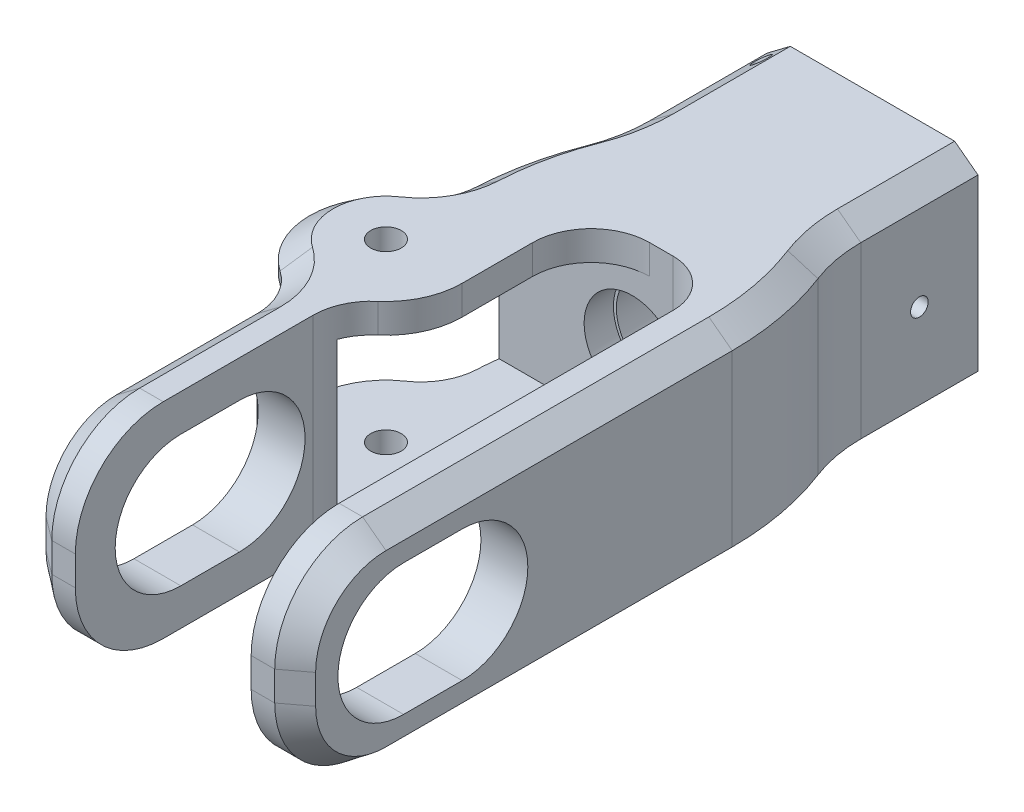
from build123d import *
from OCP.BRepFilletAPI import BRepFilletAPI_MakeChamfer
from build123d.topology import SkipClean

# Parameters (mm, degrees)
SKETCH1_W               = 46
SKETCH1_H               = 35
SKETCH1_R               = 7.7
BOSS_EXTRUDE1_DEPTH     = 36
BOSS_EXTRUDE2_START     = 1
SKETCH2_R               = 11
SKETCH2_R_2             = 7.7
BOSS_EXTRUDE2_DEPTH     = 1
SKETCH5_W               = 8
SKETCH5_H               = 35
BOSS_EXTRUDE4_DEPTH     = 85
SKETCH3_W               = 38
SKETCH3_H               = 35
SKETCH3_R               = 8.2
BOSS_EXTRUDE3_DEPTH     = 5
CUT_EXTRUDE1_DEPTH      = 125.403577119
CUT_EXTRUDE1_DEPTH_BACK = 125.403577119
SKETCH4_R               = 2.6
BOSS_EXTRUDE6_REACH     = 130.043
SKETCH9_W               = 8
SKETCH9_H               = 35
BOSS_EXTRUDE5_DEPTH     = 80
FILLET1_R               = 15
FILLET9_R               = 10
FILLET11_R              = 8
CUT_EXTRUDE2_DEPTH      = 35
FILLET12_R              = 50
SKETCH6_W               = 26
SKETCH6_H               = 36
CUT_EXTRUDE3_DEPTH      = 12.5
FILLET13_R              = 10
CUT_EXTRUDE4_REACH      = 132.626
CHAMFER1_SIZE           = 3
CHAMFER1_SIZE2          = 3.981134465
CUT_EXTRUDE5_REACH      = 134.47
CUT_EXTRUDE5_END_RADIUS = 7.7
SKETCH23_R              = 1.5
SKETCH25_R              = 1.5
CUT_EXTRUDE6_DEPTH      = 10


with BuildPart() as part:
    # Sketch1 → Boss-Extrude1 (new body)
    with BuildSketch(Plane.XY):
        Rectangle(SKETCH1_W, SKETCH1_H)
        Circle(SKETCH1_R, mode=Mode.SUBTRACT)
    extrude(amount=BOSS_EXTRUDE1_DEPTH)

    # Sketch2 → Boss-Extrude2 (add)
    with SkipClean():  # the faces are left unmerged after this step: merging them gives an invalid solid
        with BuildSketch(Plane(origin=(0, 0, 0), x_dir=(-1, 0, 0), z_dir=(0, 0, -1)).offset(BOSS_EXTRUDE2_START)):
            Circle(SKETCH2_R)
            Circle(SKETCH2_R_2, mode=Mode.SUBTRACT)
        extrude(amount=-BOSS_EXTRUDE2_DEPTH)

    # Sketch5 → Boss-Extrude4 (add)
    with SkipClean():  # the faces are left unmerged after this step: merging them gives an invalid solid
        with BuildSketch(Plane.XY.offset(36)):
            with Locations((-19, 0)):
                Rectangle(SKETCH5_W, SKETCH5_H)
        extrude(amount=BOSS_EXTRUDE4_DEPTH)

    # Sketch3 → Boss-Extrude3 (add)
    with BuildSketch(Plane.XY.offset(36)):
        with Locations((4, 0)):
            Rectangle(SKETCH3_W, SKETCH3_H)
        Circle(SKETCH3_R, mode=Mode.SUBTRACT)
    extrude(amount=BOSS_EXTRUDE3_DEPTH)

    # Sketch4 → Cut-Extrude1 (cut, two sides: drawn at the far end of the back side and taken through both)
    with BuildSketch(Plane(origin=(0, 0, 0), x_dir=(1, 0, 0), z_dir=(0, 1, 0)).offset(-CUT_EXTRUDE1_DEPTH_BACK)):
        with Locations(Location((-20, -63, 0), (0, 0, 270))):
            Circle(SKETCH4_R)
    extrude(amount=CUT_EXTRUDE1_DEPTH + CUT_EXTRUDE1_DEPTH_BACK, mode=Mode.SUBTRACT)

    # Boss-Extrude6: up to this face of the body (flat: up to its plane)
    boss_extrude6_end = Plane(part.part.faces().sort_by_distance((-4.685176782, -17.5, 35.598204078))[0])
    # Sketch10 → Boss-Extrude6 (add, up to the picked face)
    with BuildSketch(Plane(origin=(0, 17.5, 0), x_dir=(1, 0, 0), z_dir=(0, 1, 0)), mode=Mode.PRIVATE) as boss_extrude6_sk1:
        with BuildLine():
            Line((-23, -50.350889359), (-23, -75.649110641))
            ThreePointArc((-23, -75.649110641), (-33, -63), (-23, -50.350889359))
        make_face()
    boss_extrude6_tool1 = split(extrude(boss_extrude6_sk1.sketch, amount=-BOSS_EXTRUDE6_REACH, mode=Mode.PRIVATE), bisect_by=boss_extrude6_end, keep=Keep.BOTH, mode=Mode.PRIVATE)
    # Sketch10 → Boss-Extrude6 (add, up to the picked face)
    with BuildSketch(Plane(origin=(0, 17.5, 0), x_dir=(1, 0, 0), z_dir=(0, 1, 0)), mode=Mode.PRIVATE) as boss_extrude6_sk2:
        with BuildLine():
            Line((-15, -41), (-15, -75))
            ThreePointArc((-15, -75), (-9.183346174, -70.211102551), (-7, -63))
            Line((-7, -63), (-7, -41))
            Line((-7, -41), (-15, -41))
        make_face()
    boss_extrude6_tool2 = split(extrude(boss_extrude6_sk2.sketch, amount=-BOSS_EXTRUDE6_REACH, mode=Mode.PRIVATE), bisect_by=boss_extrude6_end, keep=Keep.BOTH, mode=Mode.PRIVATE)
    add(boss_extrude6_tool1.solids().sort_by(Axis((-27.170601, 17.5, 63), (0, -1, 0)))[0])
    add(boss_extrude6_tool2.solids().sort_by(Axis((-11.197055, 17.5, 56.457565), (0, -1, 0)))[0])

    # Sketch9 → Boss-Extrude5 (add)
    with BuildSketch(Plane.XY.offset(41)):
        with Locations((19, 0)):
            Rectangle(SKETCH9_W, SKETCH9_H)
    extrude(amount=BOSS_EXTRUDE5_DEPTH)

    # Fillet1
    fillet1_edges = [part.edges().sort_by_distance(p)[0] for p in [
        (-19, -17.5, 121),
        (-19, 17.5, 121),
        (19, 17.5, 121),
        (19, -17.5, 121),
    ]]
    fillet(fillet1_edges, radius=FILLET1_R)

    # Fillet9
    fillet9_edges = [part.edges().sort_by_distance(p)[0] for p in [
        (-23, 0, 75.649110641),
        (-23, 0, 50.350889359),
        (-15, 0, 75),
    ]]
    fillet(fillet9_edges, radius=FILLET9_R)

    # Fillet11
    fillet11_edges = [part.edges().sort_by_distance(p)[0] for p in [
        (15, 0, 41),
    ]]
    fillet(fillet11_edges, radius=FILLET11_R)

    # Sketch20 → Cut-Extrude2 (cut)
    with BuildSketch(Plane(origin=(0, 17.5, 0), x_dir=(1, 0, 0), z_dir=(0, 1, 0))):
        with BuildLine():
            Line((-18, 0), (-18, -20))
            ThreePointArc((-18, -20), (-19.282917549, -27.90569415), (-23, -35))
            Line((-23, -35), (-23, 0))
            Line((-23, 0), (-18, 0))
        make_face()
        with BuildLine():
            Line((18, -20), (18, 0))
            Line((18, 0), (23, 0))
            Line((23, 0), (23, -35))
            ThreePointArc((23, -35), (19.282917549, -27.90569415), (18, -20))
        make_face()
    extrude(amount=-CUT_EXTRUDE2_DEPTH, mode=Mode.SUBTRACT)

    # Fillet12
    # the kernel refuses this fillet: 50 mm, written as the material it takes off along each edge
    with BuildSketch(Plane(origin=(23, 47.314560089, 35), x_dir=(0, 0, 1), z_dir=(0, -1, 0))) as fillet12_piece_1:
        with BuildLine():
            CenterArc((11.925824036, 50), FILLET12_R, 248.960530219, 21.039469781)
            ThreePointArc((-6.024725321, 3.333333333), (-2.897057104, 1.87507196), (0, 0))
            Line((0, 0), (11.925824036, 0))
        make_face()
    extrude(amount=94.629120178, mode=Mode.SUBTRACT)
    with BuildSketch(Plane(origin=(-23, 41.360846345, 35), x_dir=(0.4854209335921463, 0, -0.8742805712301568), z_dir=(0, -1, 0))) as fillet12_piece_2:
        with BuildLine():
            CenterArc((13.623159586, 49.533850857), FILLET12_R, 243.929167388, 18.240989477)
            Line((-8.350938249, 4.621279963), (-10.548348032, 0.130022873))
            ThreePointArc((-10.548348032, 0.130022873), (-10.318653148, 0.01016864), (-2.427104668, -4.371402856))
            Line((-2.427104668, -4.371402856), (0.681157979, -4.953385086))
            ThreePointArc((0.681157979, -4.953385086), (3.405789897, -4.766925428), (6.130421814, -4.953385086))
            Line((6.130421814, -4.953385086), (6.811579793, 0))
        make_face()
    extrude(amount=82.721692689, mode=Mode.SUBTRACT)

    # Sketch6 → Cut-Extrude3 (cut, symmetric)
    with BuildSketch(Plane(origin=(0, 0, 0), x_dir=(1, 0, 0), z_dir=(0, 1, 0))):
        with Locations((-20, -59)):
            Rectangle(SKETCH6_W, SKETCH6_H)
    extrude(amount=CUT_EXTRUDE3_DEPTH, both=True, mode=Mode.SUBTRACT)

    # Fillet13
    fillet13_edges = [part.edges().sort_by_distance(p)[0] for p in [
        (-7, 15, 41),
        (-7, -15, 41),
    ]]
    fillet(fillet13_edges, radius=FILLET13_R)

    # Cut-Extrude4: up to this face of the body (flat: up to its plane)
    cut_extrude4_end = Plane(part.part.faces().sort_by_distance((23, 0, 82.65958398))[0])
    # Sketch22 → Cut-Extrude4 (cut, up to the picked face)
    with BuildSketch(Plane.ZY.offset(23), mode=Mode.PRIVATE) as cut_extrude4_sk1:
        with BuildLine():
            Line((93, 11.2), (103, 11.2))
            ThreePointArc((103, 11.2), (114.2, 0), (103, -11.2))
            Line((103, -11.2), (93, -11.2))
            ThreePointArc((93, -11.2), (81.8, 0), (93, 11.2))
        make_face()
    cut_extrude4_tool1 = split(extrude(cut_extrude4_sk1.sketch, amount=-CUT_EXTRUDE4_REACH, mode=Mode.PRIVATE), bisect_by=cut_extrude4_end, keep=Keep.BOTH, mode=Mode.PRIVATE)
    add(cut_extrude4_tool1.solids().sort_by(Axis((-23, 0, 98), (1, 0, 0)))[0], mode=Mode.SUBTRACT)

    # Chamfer1: one chamfer whose edges measure the first distance from different faces: ONE call of the kernel's chamfer builder (chamfer() names one face for all edges)
    chamfer1_edges_1 = [part.edges().sort_by_distance(p)[0] for p in [
        (-23, 17.5, 93.986832981),
        (-23, 0, 121),
        (-23, 13.106601718, 116.606601718),
        (-23, -13.106601718, 116.606601718),
        (-23, -17.5, 93.986832981),
    ]]
    chamfer1_side_1 = [part.faces().sort_by_distance(p)[0] for p in [
        (-23, -16.975781081, 93.986832981),
    ]]
    chamfer1_edges_2 = [part.edges().sort_by_distance(p)[0] for p in [
        (-33, -17.5, 63),
    ]]
    chamfer1_side_2 = [part.faces().sort_by_distance(p)[0] for p in [
        (-33, -15, 63),
    ]]
    chamfer1_edges_3 = [part.edges().sort_by_distance(p)[0] for p in [
        (-33, 17.5, 63),
    ]]
    chamfer1_side_3 = [part.faces().sort_by_distance(p)[0] for p in [
        (-33, 15, 63),
    ]]
    chamfer1_edges_4 = [part.edges().sort_by_distance(p)[0] for p in [
        (-24.277251002, -17.5, 48.916492514),
    ]]
    chamfer1_side_4 = [part.faces().sort_by_distance(p)[0] for p in [
        (-24.277251002, -15, 48.916492514),
    ]]
    chamfer1_edges_5 = [part.edges().sort_by_distance(p)[0] for p in [
        (-24.153482631, 17.5, 77.31114192),
        (-24.153482631, -17.5, 77.31114192),
    ]]
    chamfer1_side_5 = [part.faces().sort_by_distance(p)[0] for p in [
        (-24.153482631, 0, 77.31114192),
    ]]
    chamfer1_edges_6 = [part.edges().sort_by_distance(p)[0] for p in [
        (-18, 17.5, 10),
        (-18, -17.5, 10),
    ]]
    chamfer1_side_6 = [part.faces().sort_by_distance(p)[0] for p in [
        (-18, 0, 10),
    ]]
    chamfer1_edges_7 = [part.edges().sort_by_distance(p)[0] for p in [
        (-18.427026171, -17.5, 24.600973508),
        (-18.427026171, 17.5, 24.600973508),
    ]]
    chamfer1_side_7 = [part.faces().sort_by_distance(p)[0] for p in [
        (-18.427026171, 0, 24.600973508),
    ]]
    chamfer1_edges_8 = [part.edges().sort_by_distance(p)[0] for p in [
        (18.420197994, 17.5, 24.564354646),
        (18.420197994, -17.5, 24.564354646),
    ]]
    chamfer1_side_8 = [part.faces().sort_by_distance(p)[0] for p in [
        (18.420197994, 0, 24.564354646),
    ]]
    chamfer1_edges_9 = [part.edges().sort_by_distance(p)[0] for p in [
        (18, 17.5, 10),
        (18, -17.5, 10),
    ]]
    chamfer1_side_9 = [part.faces().sort_by_distance(p)[0] for p in [
        (18, 0, 10),
    ]]
    chamfer1_edges_10 = [part.edges().sort_by_distance(p)[0] for p in [
        (-24.277251002, 17.5, 48.916492514),
    ]]
    chamfer1_side_10 = [part.faces().sort_by_distance(p)[0] for p in [
        (-24.277251002, 15, 48.916492514),
    ]]
    chamfer1_edges_11 = [part.edges().sort_by_distance(p)[0] for p in [
        (-21.971591885, 17.5, 36.66215096),
        (-21.971591885, -17.5, 36.66215096),
    ]]
    chamfer1_side_11 = [part.faces().sort_by_distance(p)[0] for p in [
        (-21.971591885, 0, 36.66215096),
    ]]
    chamfer1_edges_12 = [part.edges().sort_by_distance(p)[0] for p in [
        (22.159604013, 17.5, 37.797114744),
        (22.159604013, -17.5, 37.797114744),
    ]]
    chamfer1_side_12 = [part.faces().sort_by_distance(p)[0] for p in [
        (22.159604013, 0, 37.797114744),
    ]]
    chamfer1_edges_13 = [part.edges().sort_by_distance(p)[0] for p in [
        (23, 0, 121),
        (23, 17.5, 76.462912018),
        (23, -17.5, 76.462912018),
        (23, 13.106601718, 116.606601718),
        (23, -13.106601718, 116.606601718),
    ]]
    chamfer1_side_13 = [part.faces().sort_by_distance(p)[0] for p in [
        (23, 0, 77.610644397),
    ]]
    chamfer1 = BRepFilletAPI_MakeChamfer(part.part.solid().wrapped)
    for e in chamfer1_edges_1:
        chamfer1.Add(CHAMFER1_SIZE, CHAMFER1_SIZE2, e.wrapped, chamfer1_side_1[0].wrapped)  # the first distance lies on this face
    for e in chamfer1_edges_2:
        chamfer1.Add(CHAMFER1_SIZE, CHAMFER1_SIZE2, e.wrapped, chamfer1_side_2[0].wrapped)  # the first distance lies on this face
    for e in chamfer1_edges_3:
        chamfer1.Add(CHAMFER1_SIZE, CHAMFER1_SIZE2, e.wrapped, chamfer1_side_3[0].wrapped)  # the first distance lies on this face
    for e in chamfer1_edges_4:
        chamfer1.Add(CHAMFER1_SIZE, CHAMFER1_SIZE2, e.wrapped, chamfer1_side_4[0].wrapped)  # the first distance lies on this face
    for e in chamfer1_edges_5:
        chamfer1.Add(CHAMFER1_SIZE, CHAMFER1_SIZE2, e.wrapped, chamfer1_side_5[0].wrapped)  # the first distance lies on this face
    for e in chamfer1_edges_6:
        chamfer1.Add(CHAMFER1_SIZE, CHAMFER1_SIZE2, e.wrapped, chamfer1_side_6[0].wrapped)  # the first distance lies on this face
    for e in chamfer1_edges_7:
        chamfer1.Add(CHAMFER1_SIZE, CHAMFER1_SIZE2, e.wrapped, chamfer1_side_7[0].wrapped)  # the first distance lies on this face
    for e in chamfer1_edges_8:
        chamfer1.Add(CHAMFER1_SIZE, CHAMFER1_SIZE2, e.wrapped, chamfer1_side_8[0].wrapped)  # the first distance lies on this face
    for e in chamfer1_edges_9:
        chamfer1.Add(CHAMFER1_SIZE, CHAMFER1_SIZE2, e.wrapped, chamfer1_side_9[0].wrapped)  # the first distance lies on this face
    for e in chamfer1_edges_10:
        chamfer1.Add(CHAMFER1_SIZE, CHAMFER1_SIZE2, e.wrapped, chamfer1_side_10[0].wrapped)  # the first distance lies on this face
    for e in chamfer1_edges_11:
        chamfer1.Add(CHAMFER1_SIZE, CHAMFER1_SIZE2, e.wrapped, chamfer1_side_11[0].wrapped)  # the first distance lies on this face
    for e in chamfer1_edges_12:
        chamfer1.Add(CHAMFER1_SIZE, CHAMFER1_SIZE2, e.wrapped, chamfer1_side_12[0].wrapped)  # the first distance lies on this face
    for e in chamfer1_edges_13:
        chamfer1.Add(CHAMFER1_SIZE, CHAMFER1_SIZE2, e.wrapped, chamfer1_side_13[0].wrapped)  # the first distance lies on this face
    add(Compound.cast(chamfer1.Shape()), mode=Mode.REPLACE)

    # Cut-Extrude5: up to this cylinder (the profile starts outside it)
    cut_extrude5_end = Plane(origin=(0, 0, 10), z_dir=(0, 0, -1)) * Cylinder(CUT_EXTRUDE5_END_RADIUS, 285.34, mode=Mode.PRIVATE)
    # Sketch23 → Cut-Extrude5 (cut, up to the surface)
    with BuildSketch(Plane(origin=(18, 0, 0), x_dir=(0, 0, -1), z_dir=(1, 0, 0)), mode=Mode.PRIVATE) as cut_extrude5_sk1:
        with Locations((-10, 0)):
            Circle(SKETCH23_R)
    cut_extrude5_tool1 = extrude(cut_extrude5_sk1.sketch, amount=-CUT_EXTRUDE5_REACH, mode=Mode.PRIVATE) - cut_extrude5_end
    add(cut_extrude5_tool1.solids().sort_by_distance((18, 0, 10))[0], mode=Mode.SUBTRACT)

    # Sketch25 → Cut-Extrude6 (cut)
    with BuildSketch(Plane(origin=(-13.488411093, 17.899726093, 0), x_dir=(0.7986355100472918, 0.6018150231520498, 0), z_dir=(-0.6018150231520497, 0.7986355100472917, 0))):
        with Locations(Location((-3.156661133, -3, 0), (0, 0, 180))):
            Circle(SKETCH25_R)
    extrude(amount=-CUT_EXTRUDE6_DEPTH, mode=Mode.SUBTRACT)


solid = part.part
